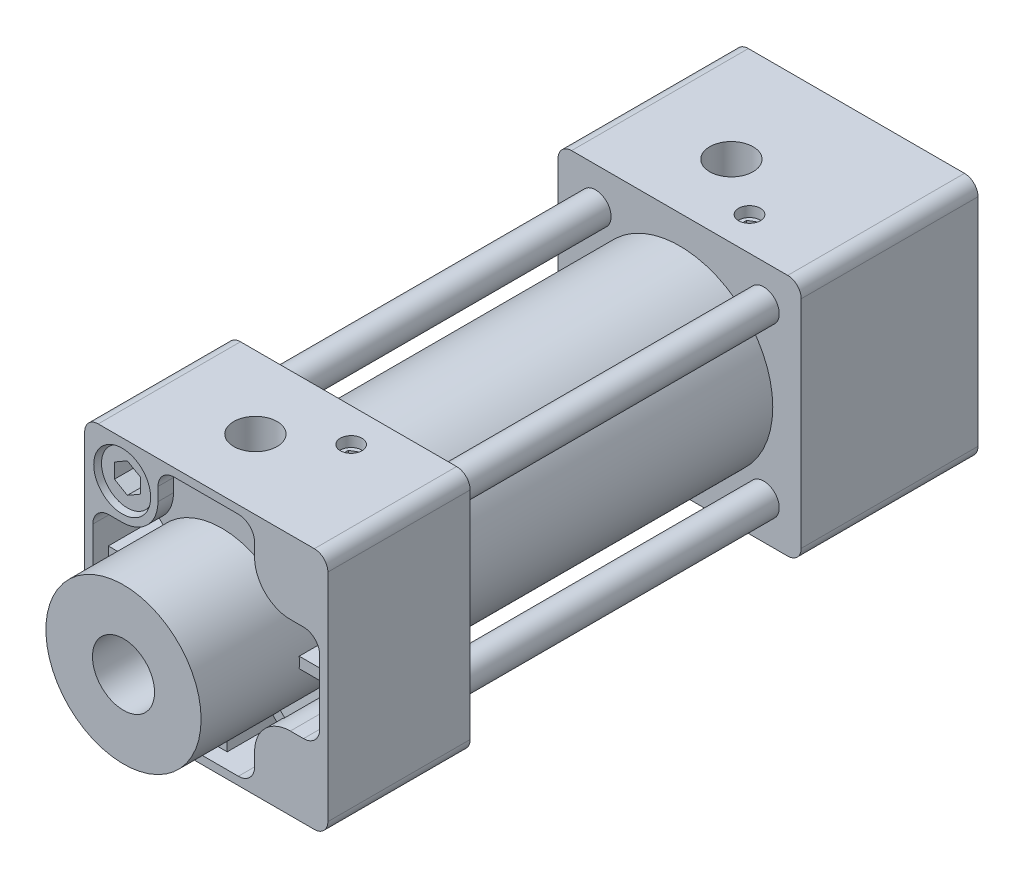
from build123d import *
from build123d.topology import SkipClean

# Parameters (mm, degrees)
EXTRUDE_1_DEPTH           = 27.5
SKETCH_4_R                = 18
EXTRUDE_2_DEPTH           = 64
SKETCH_5_R                = 5.5
SKETCH_5_R_2              = 5
CUT_EXTRUDE_1_DEPTH       = 5.5
SKETCH_6_R                = 5
CUT_EXTRUDE_2_DEPTH       = 1
CUT_EXTRUDE_15_DEPTH      = 17.5
CUT_EXTRUDE_19_DEPTH      = 3
EXTRUDE_START             = -5
EXTRUDE_17_OUTLINE_R      = 2.1
EXTRUDE_17_DEPTH          = 3
EXTRUDE_START_2           = -5.018326522
EXTRUDE_17_2_DEPTH        = 0.018326522
CUT_EXTRUDE_23_DEPTH      = 1.9
SKETCH_45_R               = 15
EXTRUDE_16_DEPTH          = 19
EXTRUDE_13_REACH          = 114.52
SKETCH_35_R               = 3
SKETCH_46_R               = 6
CUT_EXTRUDE_20_DEPTH      = 43.5
SKETCH_47_R               = 16
CUT_EXTRUDE_21_DEPTH      = 28
SCALE_1_SCALE             = 0.75
CUT_EXTRUDE_25_DEPTH      = 25
CUT_EXTRUDE_25_DEPTH_BACK = 20
SKETCH_56_R               = 12
EXTRUDE_START_3           = 5
EXTRUDE_18_DEPTH          = 5


# Read off the part's stored shape, not the designer's step: 凸台-拉伸17, M6 螺纹孔1
with BuildPart() as part:
    # 草图3 → Extrude 1 (new body)
    with BuildSketch(Plane.XY):
        with BuildLine():
            Line((20.888888889, 23.5), (-20.888888889, 23.5))
            ThreePointArc((-20.888888889, 23.5), (-22.735223262, 22.735223262), (-23.5, 20.888888889))
            Line((-23.5, 20.888888889), (-23.5, -20.888888889))
            ThreePointArc((-23.5, -20.888888889), (-22.735223262, -22.735223262), (-20.888888889, -23.5))
            Line((-20.888888889, -23.5), (20.888888889, -23.5))
            ThreePointArc((20.888888889, -23.5), (22.735223262, -22.735223262), (23.5, -20.888888889))
            Line((23.5, -20.888888889), (23.5, 20.888888889))
            ThreePointArc((23.5, 20.888888889), (22.735223262, 22.735223262), (20.888888889, 23.5))
        make_face()
    extrude(amount=EXTRUDE_1_DEPTH)

    # 草图5 → 切除-拉伸1 (cut)
    # profile 1 of 2: a face of its own
    with BuildSketch(Plane(origin=(0, 0, 0), x_dir=(-1, 0, 0), z_dir=(0, 0, -1))):
        with Locations((16.25, 16.25)):
            Circle(SKETCH_5_R)
        with Locations((16.25, 16.25)):
            Circle(SKETCH_5_R_2, mode=Mode.SUBTRACT)
    # profile 2 of 2: a face of its own
    with BuildSketch(Plane(origin=(0, 0, 0), x_dir=(-1, 0, 0), z_dir=(0, 0, -1))):
        Polygon((13.75, 14.806624327), (13.75, 17.693375673), (16.25, 19.136751346), (18.75, 17.693375673), (18.75, 14.806624327), (16.25, 13.363248654), align=None)
    extrude(amount=-CUT_EXTRUDE_1_DEPTH, mode=Mode.SUBTRACT)

    # 草图6 → 切除-拉伸2 (cut)
    with BuildSketch(Plane(origin=(0, 0, 0), x_dir=(-1, 0, 0), z_dir=(0, 0, -1))):
        with Locations((16.25, 16.25)):
            Circle(SKETCH_6_R)
        Polygon((16.25, 19.136751346), (18.75, 17.693375673), (18.75, 14.806624327), (16.25, 13.363248654), (13.75, 14.806624327), (13.75, 17.693375673), align=None, mode=Mode.SUBTRACT)
    extrude(amount=-CUT_EXTRUDE_2_DEPTH, mode=Mode.SUBTRACT)

    # 草图18 → 切除-拉伸15 (cut)
    with BuildSketch(Plane(origin=(0, 0, 0), x_dir=(-1, 0, 0), z_dir=(0, 0, -1))):
        with BuildLine():
            Line((-11.319392311, 9.842324812), (-12.157326584, 10.680259086))
            ThreePointArc((-12.157326584, 10.680259086), (-14.096461858, 9.682331996), (-16.25, 9.338271595))
            Line((-16.25, 9.338271595), (-18.8, 9.338271595))
            ThreePointArc((-18.8, 9.338271595), (-21.015601248, 8.42053951), (-21.933333333, 6.204938262))
            Line((-21.933333333, 6.204938262), (-21.933333333, 1.044444444))
            Line((-21.933333333, 1.044444444), (-14.963593679, 1.044444444))
            ThreePointArc((-14.963593679, 1.044444444), (-13.858192988, 5.740251485), (-11.319392311, 9.842324812))
        make_face()
        with BuildLine():
            ThreePointArc((-11.319392311, -9.842324812), (-13.858192988, -5.740251485), (-14.963593679, -1.044444444))
            Line((-14.963593679, -1.044444444), (-21.933333333, -1.044444444))
            Line((-21.933333333, -1.044444444), (-21.933333333, -6.204938262))
            ThreePointArc((-21.933333333, -6.204938262), (-21.015601248, -8.42053951), (-18.8, -9.338271595))
            Line((-18.8, -9.338271595), (-16.25, -9.338271595))
            ThreePointArc((-16.25, -9.338271595), (-14.096461858, -9.682331996), (-12.157326584, -10.680259086))
            Line((-12.157326584, -10.680259086), (-11.319392311, -9.842324812))
        make_face()
        with BuildLine():
            ThreePointArc((-1.044444444, -14.963593679), (-5.740251485, -13.858192988), (-9.842324812, -11.319392311))
            Line((-9.842324812, -11.319392311), (-10.680259086, -12.157326584))
            ThreePointArc((-10.680259086, -12.157326584), (-9.682331996, -14.096461858), (-9.338271595, -16.25))
            Line((-9.338271595, -16.25), (-9.338271595, -18.8))
            ThreePointArc((-9.338271595, -18.8), (-8.42053951, -21.015601248), (-6.204938262, -21.933333333))
            Line((-6.204938262, -21.933333333), (-1.044444444, -21.933333333))
            Line((-1.044444444, -21.933333333), (-1.044444444, -14.963593679))
        make_face()
        with BuildLine():
            Line((10.680259086, -12.157326584), (9.842324812, -11.319392311))
            ThreePointArc((9.842324812, -11.319392311), (5.740251485, -13.858192988), (1.044444444, -14.963593679))
            Line((1.044444444, -14.963593679), (1.044444444, -21.933333333))
            Line((1.044444444, -21.933333333), (6.204938262, -21.933333333))
            ThreePointArc((6.204938262, -21.933333333), (8.42053951, -21.015601248), (9.338271595, -18.8))
            Line((9.338271595, -18.8), (9.338271595, -16.25))
            ThreePointArc((9.338271595, -16.25), (9.682331996, -14.096461858), (10.680259086, -12.157326584))
        make_face()
        with BuildLine():
            Line((21.933333333, -6.204938262), (21.933333333, -1.044444444))
            Line((21.933333333, -1.044444444), (14.963593679, -1.044444444))
            ThreePointArc((14.963593679, -1.044444444), (13.858192988, -5.740251485), (11.319392311, -9.842324812))
            Line((11.319392311, -9.842324812), (12.157326584, -10.680259086))
            ThreePointArc((12.157326584, -10.680259086), (14.096461858, -9.682331996), (16.25, -9.338271595))
            Line((16.25, -9.338271595), (18.8, -9.338271595))
            ThreePointArc((18.8, -9.338271595), (21.015601248, -8.42053951), (21.933333333, -6.204938262))
        make_face()
        with BuildLine():
            ThreePointArc((16.25, 9.338271595), (14.096461858, 9.682331996), (12.157326584, 10.680259086))
            Line((12.157326584, 10.680259086), (11.319392311, 9.842324812))
            ThreePointArc((11.319392311, 9.842324812), (13.858192988, 5.740251485), (14.963593679, 1.044444444))
            Line((14.963593679, 1.044444444), (21.933333333, 1.044444444))
            Line((21.933333333, 1.044444444), (21.933333333, 6.204938262))
            ThreePointArc((21.933333333, 6.204938262), (21.015601248, 8.42053951), (18.8, 9.338271595))
            Line((18.8, 9.338271595), (16.25, 9.338271595))
        make_face()
    extrude(amount=-CUT_EXTRUDE_15_DEPTH, mode=Mode.SUBTRACT)

    # 草图43 → 切除-拉伸19 (cut)
    with SkipClean():  # the faces are left unmerged after this step: merging them gives an invalid solid
        with BuildSketch(Plane(origin=(0, 0, 0), x_dir=(-1, 0, 0), z_dir=(0, 0, -1))):
            with BuildLine():
                Line((-6.204938262, 21.933333333), (6.204938262, 21.933333333))
                ThreePointArc((6.204938262, 21.933333333), (8.42053951, 21.015601248), (9.338271595, 18.8))
                Line((9.338271595, 18.8), (9.338271595, 16.25))
                ThreePointArc((9.338271595, 16.25), (11.362669975, 11.362669975), (16.25, 9.338271595))
                Line((16.25, 9.338271595), (18.8, 9.338271595))
                ThreePointArc((18.8, 9.338271595), (21.015601248, 8.42053951), (21.933333333, 6.204938262))
                Line((21.933333333, 6.204938262), (21.933333333, -6.204938262))
                ThreePointArc((21.933333333, -6.204938262), (21.015601248, -8.42053951), (18.8, -9.338271595))
                Line((18.8, -9.338271595), (16.25, -9.338271595))
                ThreePointArc((16.25, -9.338271595), (11.362669975, -11.362669975), (9.338271595, -16.25))
                Line((9.338271595, -16.25), (9.338271595, -18.8))
                ThreePointArc((9.338271595, -18.8), (8.42053951, -21.015601248), (6.204938262, -21.933333333))
                Line((6.204938262, -21.933333333), (-6.204938262, -21.933333333))
                ThreePointArc((-6.204938262, -21.933333333), (-8.42053951, -21.015601248), (-9.338271595, -18.8))
                Line((-9.338271595, -18.8), (-9.338271595, -16.25))
                ThreePointArc((-9.338271595, -16.25), (-11.362669975, -11.362669975), (-16.25, -9.338271595))
                Line((-16.25, -9.338271595), (-18.8, -9.338271595))
                ThreePointArc((-18.8, -9.338271595), (-21.015601248, -8.42053951), (-21.933333333, -6.204938262))
                Line((-21.933333333, -6.204938262), (-21.933333333, 6.204938262))
                ThreePointArc((-21.933333333, 6.204938262), (-21.015601248, 8.42053951), (-18.8, 9.338271595))
                Line((-18.8, 9.338271595), (-16.25, 9.338271595))
                ThreePointArc((-16.25, 9.338271595), (-11.362669975, 11.362669975), (-9.338271595, 16.25))
                Line((-9.338271595, 16.25), (-9.338271595, 18.8))
                ThreePointArc((-9.338271595, 18.8), (-8.42053951, 21.015601248), (-6.204938262, 21.933333333))
            make_face()
        extrude(amount=-CUT_EXTRUDE_19_DEPTH, mode=Mode.SUBTRACT)

    # 草图48 → G1/8 螺纹孔1 (revolve, cut)
    with SkipClean():  # the faces are left unmerged after this step: merging them gives an invalid solid
        with BuildSketch(Plane(origin=(-4, 23.5, 13.5), x_dir=(0, 0, 1), z_dir=(1, 0, 0))):
            Polygon((0, 0), (0, 10.036591757), (4.193, 10), (4.193, 0), align=None)
        revolve(axis=Axis((-4, 29.85, 13.5), (0, -1, 0)), mode=Mode.SUBTRACT)

    # 草图50 → M5 螺纹孔1 (revolve, cut)
    with SkipClean():  # the faces are left unmerged after this step: merging them gives an invalid solid
        with BuildSketch(Plane(origin=(7, 23.5, 21), x_dir=(0, 0, 1), z_dir=(1, 0, 0))):
            Polygon((0, 0), (0, 5.018326422), (2.1, 5), (2.1, 0), align=None)
        revolve(axis=Axis((7, 29.85, 21), (0, -1, 0)), mode=Mode.SUBTRACT)

    # 凸台-拉伸17 outline → 凸台-拉伸17 (add)
    with SkipClean():  # the faces are left unmerged after this step: merging them gives an invalid solid
        with BuildSketch(Plane(origin=(0, 23.5, 0), x_dir=(1, 0, 0), z_dir=(0, 1, 0)).offset(EXTRUDE_START)):
            with Locations((7, -21)):
                Circle(EXTRUDE_17_OUTLINE_R)
        extrude(amount=EXTRUDE_17_DEPTH)

    # Extrude 17 2 outline → Extrude 17 2 (add)
    with SkipClean():  # the faces are left unmerged after this step: merging them gives an invalid solid
        with BuildSketch(Plane(origin=(0, 23.5, 0), x_dir=(1, 0, 0), z_dir=(0, 1, 0)).offset(EXTRUDE_START_2)):
            Polygon((7, -22.50302677), (8.301659365, -21.751513385), (8.301659365, -20.248486615), (7, -19.49697323), (5.698340635, -20.248486615), (5.698340635, -21.751513385), align=None)
        extrude(amount=EXTRUDE_17_2_DEPTH)

    # 草图53 → 切除-拉伸23 (cut)
    with SkipClean():  # the faces are left unmerged after this step: merging them gives an invalid solid
        with BuildSketch(Plane(origin=(0, 21.5, 0), x_dir=(1, 0, 0), z_dir=(0, 1, 0))):
            Polygon((8.301659365, -20.248486615), (7, -19.49697323), (5.698340635, -20.248486615), (5.698340635, -21.751513385), (7, -22.50302677), (8.301659365, -21.751513385), align=None)
        extrude(amount=-CUT_EXTRUDE_23_DEPTH, mode=Mode.SUBTRACT)


with BuildPart() as body_2:
    # 草图4 → 凸台-拉伸2 (new body)
    with BuildSketch(Plane(origin=(0, 0, 27.5), x_dir=(-1, 0, 0), z_dir=(0, 0, -1))):
        Circle(SKETCH_4_R)
    extrude(amount=-EXTRUDE_2_DEPTH)

    # 草图47 → 切除-拉伸21 (cut)
    with BuildSketch(Plane.XY.offset(91.5)):
        Circle(SKETCH_47_R)
    extrude(amount=-CUT_EXTRUDE_21_DEPTH, mode=Mode.SUBTRACT)


with BuildPart() as body_3:
    # 镜向3: mirrored copy
    add(part.part.mirror(Plane(origin=(0, 0, 59.5), x_dir=(1, 0, 0), z_dir=(0, 0, -1))))

    # 草图45 → 凸台-拉伸16 (add)
    with BuildSketch(Plane.XY.offset(116)):
        with Locations(Location((0, 0, 0), (0, 0, 176.007285347))):
            Circle(SKETCH_45_R)
    extrude(amount=EXTRUDE_16_DEPTH)


with BuildPart() as part_1:
    add(part.part)

    # 草图35 → 凸台-拉伸13 (add, up to next)
    with BuildSketch(Plane.XY.offset(27.5), mode=Mode.PRIVATE) as extrude_13_sk1:
        with Locations(Location((16.25, 16.25, 0), (0, 0, 180))):
            Circle(SKETCH_35_R)
    extrude_13_tool1 = extrude(extrude_13_sk1.sketch, amount=EXTRUDE_13_REACH, mode=Mode.PRIVATE) - body_3.part
    # 草图35 → 凸台-拉伸13 (add, up to next)
    with BuildSketch(Plane.XY.offset(27.5), mode=Mode.PRIVATE) as extrude_13_sk2:
        with Locations(Location((16.25, -16.25, 0), (0, 0, 180))):
            Circle(SKETCH_35_R)
    extrude_13_tool2 = extrude(extrude_13_sk2.sketch, amount=EXTRUDE_13_REACH, mode=Mode.PRIVATE) - body_3.part
    # 草图35 → 凸台-拉伸13 (add, up to next)
    with BuildSketch(Plane.XY.offset(27.5), mode=Mode.PRIVATE) as extrude_13_sk3:
        with Locations(Location((-16.25, -16.25, 0), (0, 0, 180))):
            Circle(SKETCH_35_R)
    extrude_13_tool3 = extrude(extrude_13_sk3.sketch, amount=EXTRUDE_13_REACH, mode=Mode.PRIVATE) - body_3.part
    # 草图35 → 凸台-拉伸13 (add, up to next)
    with BuildSketch(Plane.XY.offset(27.5), mode=Mode.PRIVATE) as extrude_13_sk4:
        with Locations(Location((-16.25, 16.25, 0), (0, 0, 180))):
            Circle(SKETCH_35_R)
    extrude_13_tool4 = extrude(extrude_13_sk4.sketch, amount=EXTRUDE_13_REACH, mode=Mode.PRIVATE) - body_3.part
    add(extrude_13_tool1.solids().sort_by_distance((16.25, 16.25, 27.5))[0])
    add(extrude_13_tool2.solids().sort_by_distance((16.25, -16.25, 27.5))[0])
    add(extrude_13_tool3.solids().sort_by_distance((-16.25, -16.25, 27.5))[0])
    add(extrude_13_tool4.solids().sort_by_distance((-16.25, 16.25, 27.5))[0])


with BuildPart() as body_3_1:
    add(body_3.part)

    # 草图46 → 切除-拉伸20 (cut)
    with BuildSketch(Plane.XY.offset(135)):
        Circle(SKETCH_46_R)
    extrude(amount=-CUT_EXTRUDE_20_DEPTH, mode=Mode.SUBTRACT)


with BuildPart() as part_2:
    # 缩放比例1: scaled about (0, 0, 0)
    add(part_1.part.scale(SCALE_1_SCALE))

    # 草图57 → 凸台-拉伸18 (add)
    with BuildSketch(Plane(origin=(0, 0, 0), x_dir=(-1, 0, 0), z_dir=(0, 0, -1)).offset(EXTRUDE_START_3)):
        with BuildLine():
            Line((-17.625, 15.666666667), (-17.625, -15.666666667))
            ThreePointArc((-17.625, -15.666666667), (-17.051417446, -17.051417446), (-15.666666667, -17.625))
            Line((-15.666666667, -17.625), (15.666666667, -17.625))
            ThreePointArc((15.666666667, -17.625), (17.051417446, -17.051417446), (17.625, -15.666666667))
            Line((17.625, -15.666666667), (17.625, 15.666666667))
            ThreePointArc((17.625, 15.666666667), (17.051417446, 17.051417446), (15.666666667, 17.625))
            Line((15.666666667, 17.625), (-15.666666667, 17.625))
            ThreePointArc((-15.666666667, 17.625), (-17.051417446, 17.051417446), (-17.625, 15.666666667))
        make_face()
    extrude(amount=-EXTRUDE_18_DEPTH)

    # M6 螺纹孔1 outline → M6 螺纹孔1 (revolve, cut)
    with BuildSketch(Plane(origin=(-13.5, 13.5, 0), x_dir=(1, 0, 0), z_dir=(0, -1, 0))):
        Polygon((2.5, -2.502151548), (0, -1), (0, -5), (2.5, -5), align=None)
    revolve(axis=Axis((-13.5, 13.5, 0), (0, 0, 1)), mode=Mode.SUBTRACT)

    # Hole Wizard M6 _1 2 outline → Hole Wizard M6 _1 2 (revolve, cut)
    with BuildSketch(Plane(origin=(13.5, -13.5, 0), x_dir=(1, 0, 0), z_dir=(0, -1, 0))):
        Polygon((2.5, -2.502151548), (0, -1), (0, -5), (2.5, -5), align=None)
    revolve(axis=Axis((13.5, -13.5, 0), (0, 0, 1)), mode=Mode.SUBTRACT)

    # Hole Wizard M6 _1 3 outline → Hole Wizard M6 _1 3 (revolve, cut)
    with BuildSketch(Plane(origin=(13.5, 13.5, 0), x_dir=(1, 0, 0), z_dir=(0, -1, 0))):
        Polygon((2.5, -2.502151548), (0, -1), (0, -5), (2.5, -5), align=None)
    revolve(axis=Axis((13.5, 13.5, 0), (0, 0, 1)), mode=Mode.SUBTRACT)

    # Hole Wizard M6 _1 4 outline → Hole Wizard M6 _1 4 (revolve, cut)
    with BuildSketch(Plane(origin=(-13.5, -13.5, 0), x_dir=(1, 0, 0), z_dir=(0, -1, 0))):
        Polygon((2.5, -2.502151548), (0, -1), (0, -5), (2.5, -5), align=None)
    revolve(axis=Axis((-13.5, -13.5, 0), (0, 0, 1)), mode=Mode.SUBTRACT)


with BuildPart() as body_3_2:
    # 缩放比例1: scaled about (0, 0, 0)
    add(body_3_1.part.scale(SCALE_1_SCALE))


with BuildPart() as body_2_1:
    # 缩放比例1: scaled about (0, 0, 0)
    add(body_2.part.scale(SCALE_1_SCALE))


with BuildPart() as cut_extrude_25_tool:
    # 草图56 → 切除-拉伸25 (new, two sides: drawn at the far end of the back side and taken through both)
    with BuildSketch(Plane.XY.offset(47.625).offset(-CUT_EXTRUDE_25_DEPTH_BACK)):
        Circle(SKETCH_56_R)
    extrude(amount=CUT_EXTRUDE_25_DEPTH + CUT_EXTRUDE_25_DEPTH_BACK)


with BuildPart() as body_2_2:
    add(body_2_1.part)

    # 切除-拉伸25: cut by cut_extrude_25_tool
    add(cut_extrude_25_tool.part, mode=Mode.SUBTRACT)


with BuildPart() as body_3_3:
    add(body_3_2.part)

    # 切除-拉伸25: cut by cut_extrude_25_tool
    add(cut_extrude_25_tool.part, mode=Mode.SUBTRACT)


solid = Compound([part_2.part, body_2_2.part, body_3_3.part])
